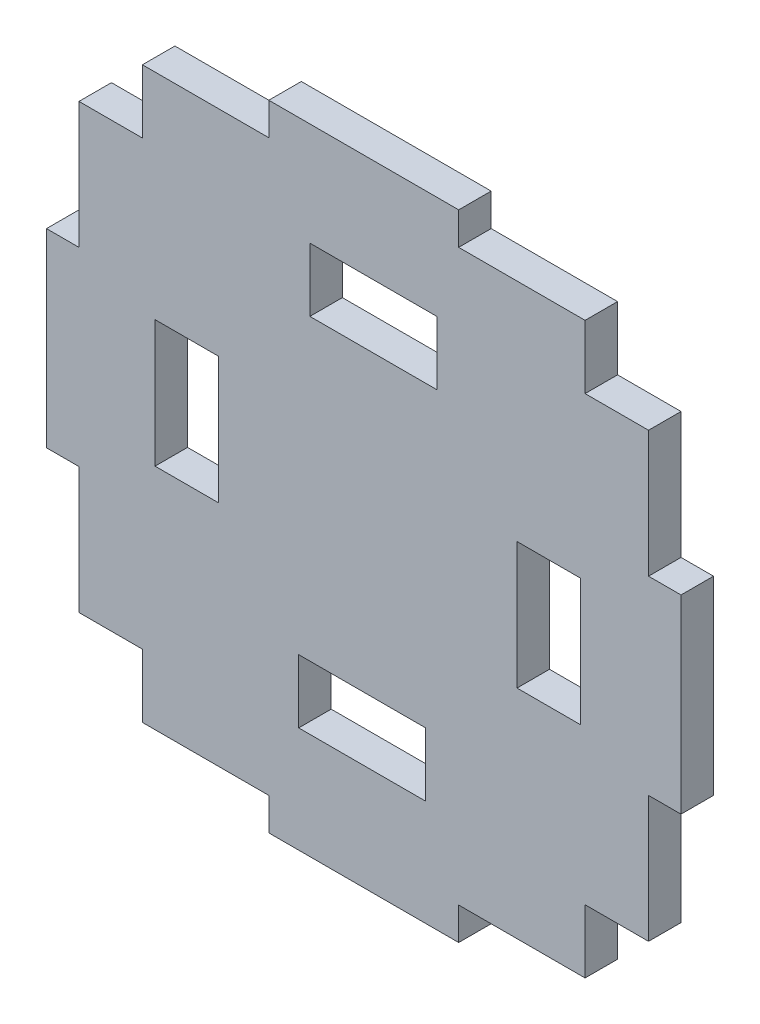
from build123d import *

# Parameters (mm, degrees)
BOSS_EXTRUDE1_DEPTH = 5.12
SKETCH2_W           = 10
SKETCH2_H           = 20
SKETCH2_H_2         = 10
SKETCH2_W_2         = 20
CUT_EXTRUDE1_DEPTH  = 137.710169127


with BuildPart() as part:
    # Sketch1 → Boss-Extrude1 (new body)
    with BuildSketch(Plane.XY):
        Polygon((31.040381921, 97.197647161), (60.960381921, 97.197647161), (60.960381921, 92.077647161), (90.880381921, 92.077647161), (90.880381921, 62.157647161), (96.000381921, 62.157647161), (96.000381921, 32.237647161), (90.880381921, 32.237647161), (90.880381921, 2.317647161), (60.960381921, 2.317647161), (60.960381921, -2.802352839), (31.040381921, -2.802352839), (31.040381921, 2.317647161), (1.120381921, 2.317647161), (1.120381921, 32.237647161), (-3.999618079, 32.237647161), (-3.999618079, 62.157647161), (1.120381921, 62.157647161), (1.120381921, 92.077647161), (31.040381921, 92.077647161), align=None)
    extrude(amount=BOSS_EXTRUDE1_DEPTH)

    # Sketch2 → Cut-Extrude1 (cut, through all)
    with BuildSketch(Plane.XY.offset(5.12)):
        with Locations((18.107977385, 48.288769468)):
            Rectangle(SKETCH2_W, SKETCH2_H)
        with Locations((6.120381921, 87.077647161)):
            Rectangle(SKETCH2_W, SKETCH2_H_2)
        with Locations((85.880381921, 87.077647161)):
            Rectangle(SKETCH2_W, SKETCH2_H_2)
        with Locations((85.880381921, 7.317647161)):
            Rectangle(SKETCH2_W, SKETCH2_H_2)
        with Locations((6.120381921, 7.317647161)):
            Rectangle(SKETCH2_W, SKETCH2_H_2)
        with Locations((45.749259615, 18.885242625)):
            Rectangle(SKETCH2_W_2, SKETCH2_H_2)
        with Locations((47.511504228, 75.930051698)):
            Rectangle(SKETCH2_W_2, SKETCH2_H_2)
        with Locations((75.152786458, 46.526524854)):
            Rectangle(SKETCH2_W, SKETCH2_H)
    extrude(amount=-CUT_EXTRUDE1_DEPTH, mode=Mode.SUBTRACT)


solid = part.part
